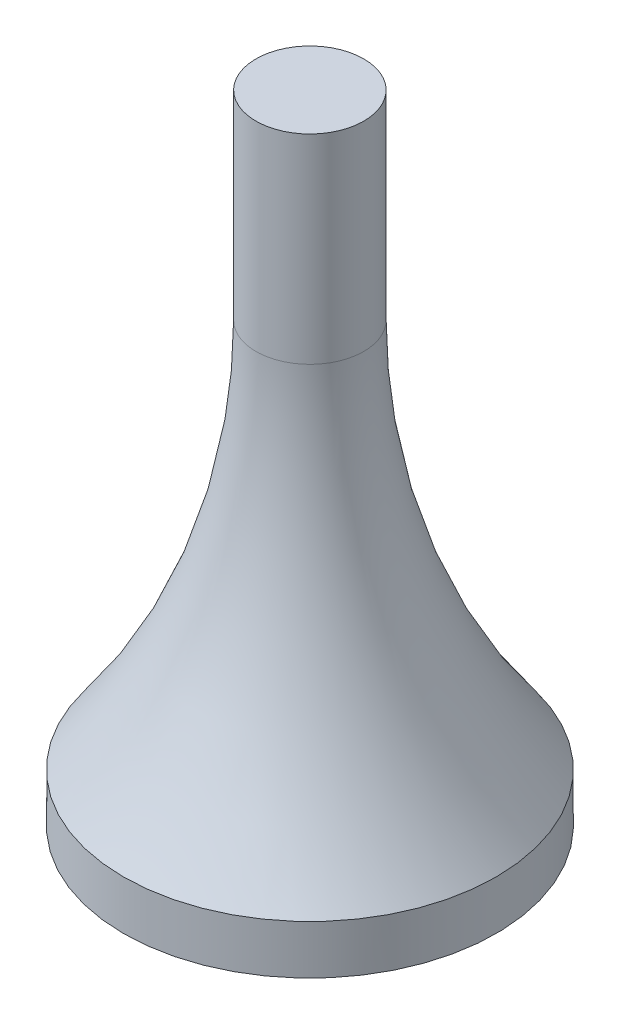
from build123d import *

# Parameters (mm, degrees)
SKETCH_1_R      = 38
EXTRUDE_1_DEPTH = 10
FILLET_1_R      = 130


with BuildPart() as part:
    # 草图1 → 凸台-拉伸1 (new body)
    with BuildSketch(Plane(origin=(0, 0, 0), x_dir=(1, 0, 0), z_dir=(0, 1, 0))):
        with Locations(Location((0, 0, 0), (0, 0, 270))):
            Circle(SKETCH_1_R)
    extrude(amount=EXTRUDE_1_DEPTH)

    # 草图3 → 旋转1 (revolve)
    with BuildSketch(Plane.XY, mode=Mode.PRIVATE) as revolve_1_sk:
        Polygon((0, 130), (11, 130), (11, 40), (38, 10), (0, 10), align=None)
    revolve(revolve_1_sk.sketch.rotate(Axis((0, 0, 0), (0, 1, 0)), 90), axis=Axis((0, 0, 0), (0, 1, 0)))

    # 圆角1
    # the kernel refuses this fillet: 130 mm, written as the material it adds along each edge
    with BuildSketch(Plane(origin=(0, 40, 0), x_dir=(0, 0, -1), z_dir=(1, 0, 0))) as fillet_1_piece_1:
        with BuildLine():
            CenterArc((141, 49.315824398), FILLET_1_R, 180, 37.598305078)
            Line((11, 49.315824398), (8.4, 49.315824398))
            Line((8.4, 49.315824398), (8.4, 0))
            Line((8.4, 0), (9.06743522, -1.739308302))
            ThreePointArc((9.06743522, -1.739308302), (22.56743522, -16.739308302), (35.94, -31.586316488))
            Line((35.94, -31.586316488), (38, -30))
        make_face()
    revolve(axis=Axis((0, 40, 0), (0, 1, 0)))


solid = part.part
